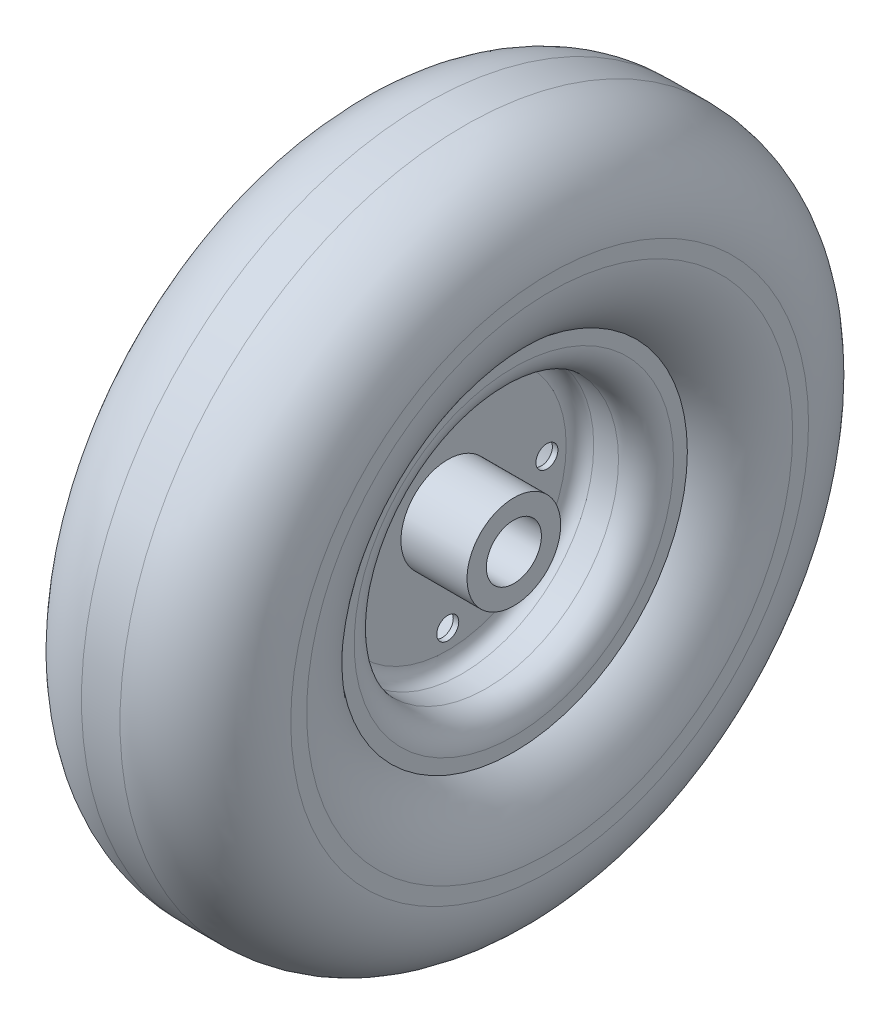
from build123d import *

# Parameters (mm, degrees)
SKETCH1_R           = 125
SKETCH1_R_2         = 10
BOSS_EXTRUDE1_DEPTH = 76
SKETCH2_R           = 48
SKETCH2_R_2         = 17
CUT_EXTRUDE1_DEPTH  = 37
CUT_EXTRUDE2_START  = -37
SKETCH3_R           = 48
SKETCH3_R_2         = 17
CUT_EXTRUDE2_DEPTH  = 37
SKETCH4_R           = 63
CUT_EXTRUDE3_DEPTH  = 13
CUT_EXTRUDE4_START  = -13
SKETCH5_R           = 63
CUT_EXTRUDE4_DEPTH  = 13
SKETCH6_R           = 4
CUT_EXTRUDE5_DEPTH  = 182.027622202
FILLET1_R           = 31
FILLET2_R           = 31
FILLET3_R           = 10
FILLET4_R           = 5


with BuildPart() as part:
    # Sketch1 → Boss-Extrude1 (new body)
    with BuildSketch(Plane(origin=(0, 0, 0), x_dir=(0, 0, -1), z_dir=(1, 0, 0))):
        Circle(SKETCH1_R)
        Circle(SKETCH1_R_2, mode=Mode.SUBTRACT)
    extrude(amount=BOSS_EXTRUDE1_DEPTH)

    # Sketch2 → Cut-Extrude1 (cut)
    with BuildSketch(Plane(origin=(76, 0, 0), x_dir=(0, 0, -1), z_dir=(1, 0, 0))):
        Circle(SKETCH2_R)
        Circle(SKETCH2_R_2, mode=Mode.SUBTRACT)
    extrude(amount=-CUT_EXTRUDE1_DEPTH, mode=Mode.SUBTRACT)

    # Sketch3 → Cut-Extrude2 (cut)
    with BuildSketch(Plane.ZY.offset(CUT_EXTRUDE2_START)):
        with Locations(Location((0, 0, 0), (0, 0, 180))):
            Circle(SKETCH3_R)
        with Locations(Location((0, 0, 0), (0, 0, 180))):
            Circle(SKETCH3_R_2, mode=Mode.SUBTRACT)
    extrude(amount=CUT_EXTRUDE2_DEPTH, mode=Mode.SUBTRACT)

    # Sketch4 → Cut-Extrude3 (cut)
    with BuildSketch(Plane.ZY):
        Circle(SKETCH4_R)
    extrude(amount=-CUT_EXTRUDE3_DEPTH, mode=Mode.SUBTRACT)

    # Sketch5 → Cut-Extrude4 (cut)
    with BuildSketch(Plane(origin=(76, 0, 0), x_dir=(0, 0, -1), z_dir=(1, 0, 0)).offset(CUT_EXTRUDE4_START)):
        with Locations(Location((0, 0, 0), (0, 0, 180))):
            Circle(SKETCH5_R)
    extrude(amount=CUT_EXTRUDE4_DEPTH, mode=Mode.SUBTRACT)

    # Sketch6 → Cut-Extrude5 (cut, through all)
    with BuildSketch(Plane(origin=(39, 0, 0), x_dir=(0, 0, -1), z_dir=(1, 0, 0))):
        with Locations((0, 36)):
            Circle(SKETCH6_R)
        with Locations((36, 0)):
            Circle(SKETCH6_R)
        with Locations((0, -36)):
            Circle(SKETCH6_R)
        with Locations((-36, 0)):
            Circle(SKETCH6_R)
    extrude(amount=-CUT_EXTRUDE5_DEPTH, mode=Mode.SUBTRACT)

    # Fillet1
    # the kernel refuses this fillet: 31 mm, written as the material it takes off along each edge
    with BuildSketch(Plane(origin=(76, 0, 0), x_dir=(0, 0, 1), z_dir=(0, 1, 0))) as fillet1_piece_1:
        with BuildLine():
            CenterArc((88.238858928, -31), FILLET1_R, 90, 54.50406735)
            Line((63, -13), (62.495222821, -12.64))
            ThreePointArc((62.495222821, -12.64), (62.38, -6.5), (62.38, 0))
            Line((62.38, 0), (63, 0.62))
            Line((63, 0.62), (88.238858928, 0.62))
            Line((88.238858928, 0.62), (88.238858928, 0))
        make_face()
    revolve(axis=Axis((76, 0, 0), (1, 0, 0)), mode=Mode.SUBTRACT)
    with BuildSketch(Plane(origin=(76, 0, 0), x_dir=(0, 0, -1), z_dir=(0, -1, 0))) as fillet1_piece_2:
        with BuildLine():
            CenterArc((125 - FILLET1_R, -FILLET1_R), FILLET1_R, 0, 90)
            Line((125 - FILLET1_R, 0), (125 - FILLET1_R, FILLET1_R * 0.02))
            Line((125 - FILLET1_R, FILLET1_R * 0.02), (125 + FILLET1_R * 0.02, FILLET1_R * 0.02))
            Line((125 + FILLET1_R * 0.02, FILLET1_R * 0.02), (125 + FILLET1_R * 0.02, -FILLET1_R))
            Line((125 + FILLET1_R * 0.02, -FILLET1_R), (125, -FILLET1_R))
        make_face()
    revolve(axis=Axis((76, 0, 0), (1, 0, 0)), mode=Mode.SUBTRACT)

    # Fillet2
    # the kernel refuses this fillet: 31 mm, written as the material it takes off along each edge
    with BuildSketch(Plane(origin=(0, 0, 0), x_dir=(0, 0, -1), z_dir=(0, -1, 0))) as fillet2_piece_1:
        with BuildLine():
            CenterArc((125 - FILLET2_R, FILLET2_R), FILLET2_R, 270, 90)
            Line((125 - FILLET2_R, 0), (125 - FILLET2_R, -FILLET2_R * 0.02))
            Line((125 - FILLET2_R, -FILLET2_R * 0.02), (125 + FILLET2_R * 0.02, -FILLET2_R * 0.02))
            Line((125 + FILLET2_R * 0.02, -FILLET2_R * 0.02), (125 + FILLET2_R * 0.02, FILLET2_R))
            Line((125 + FILLET2_R * 0.02, FILLET2_R), (125, FILLET2_R))
        make_face()
    revolve(axis=Axis((0, 0, 0), (1, 0, 0)), mode=Mode.SUBTRACT)
    with BuildSketch(Plane(origin=(0, 0, 0), x_dir=(0, 0, 1), z_dir=(0, -1, 0))) as fillet2_piece_2:
        with BuildLine():
            CenterArc((88.238858928, -31), FILLET2_R, 90, 54.50406735)
            Line((63, -13), (62.495222821, -12.64))
            ThreePointArc((62.495222821, -12.64), (62.38, -6.5), (62.38, 0))
            Line((62.38, 0), (63, 0.62))
            Line((63, 0.62), (88.238858928, 0.62))
            Line((88.238858928, 0.62), (88.238858928, 0))
        make_face()
    revolve(axis=Axis((0, 0, 0), (-1, 0, 0)), mode=Mode.SUBTRACT)

    # Fillet3
    fillet3_edges = [part.edges().sort_by_distance(p)[0] for p in [
        (13, 0, 48),
        (63, 0, 48),
    ]]
    fillet(fillet3_edges, radius=FILLET3_R)

    # Fillet4
    fillet4_edges = [part.edges().sort_by_distance(p)[0] for p in [
        (39, 0, 48),
        (37, 0, 48),
    ]]
    fillet(fillet4_edges, radius=FILLET4_R)


solid = part.part
